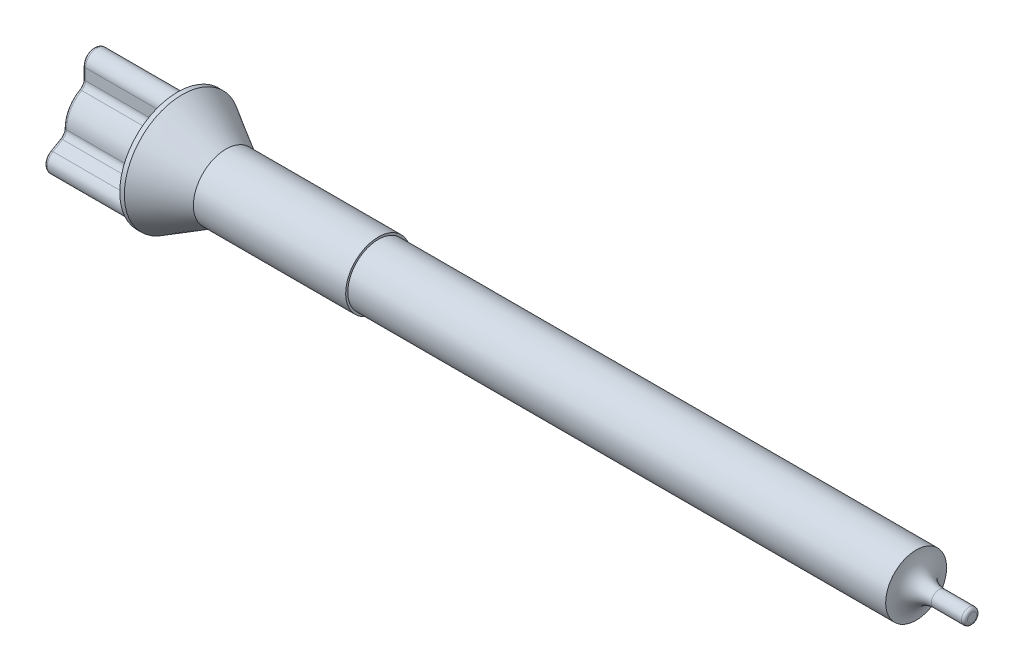
from build123d import *

# Parameters (mm, degrees)
Y_KSEKLIK_EKSTR_ZYON1_DEPTH = 2.75
DAIRESEL_KAPLAMA1_COUNT     = 3
RADYUS1_R                   = 0.25
IZIM3_R                     = 0.25
Y_KSEKLIK_EKSTR_ZYON2_DEPTH = 1.84
RADYUS2_R                   = 0.75
RADYUS3_R                   = 0.1


with BuildPart() as part:
    # Çizim1 → Döndür1 (revolve)
    with BuildSketch(Plane.XY):
        Polygon((0, 0), (0, 1), (2.75, 1), (2.75, 1.9), (2.9, 1.9), (4.33760217, 1.07), (9.33760217, 1.07), (9.33760217, 1), (26.99760217, 1), (26.99760217, 0), align=None)
    revolve(axis=Axis((26.99760217, 0, 0), (-1, 0, 0)))

    # Çizim2 → Yükseklik-Ekstrüzyon1 (add)
    with BuildSketch(Plane.ZY):
        with BuildLine():
            Line((-0.375, 0), (0.375, 0))
            Line((0.375, 0), (0.375, 1.45))
            ThreePointArc((0.375, 1.45), (0, 1.825), (-0.375, 1.45))
            Line((-0.375, 1.45), (-0.375, 0))
        make_face()
    y_kseklik_ekstr_zyon1 = extrude(amount=-Y_KSEKLIK_EKSTR_ZYON1_DEPTH)

    # Dairesel Kaplama1: Yükseklik-Ekstrüzyon1 ×3 about axis
    dairesel_kaplama1_axis = Axis((0, 0, 0), (1, 0, 0))
    for i in range(1, DAIRESEL_KAPLAMA1_COUNT):
        add(y_kseklik_ekstr_zyon1.rotate(dairesel_kaplama1_axis, i * 360 / DAIRESEL_KAPLAMA1_COUNT))

    # Radyus1
    radyus1_edges = [part.edges().sort_by_distance(p)[0] for p in [
        (2.75, 0.5, 0.866025404),
        (1.375, 0.927024811, -0.375),
        (1.375, 0.927024811, 0.375),
        (2.75, -1, 0),
        (2.75, 0.5, -0.866025404),
        (1.375, -0.138752879, 0.990327036),
        (1.375, -0.788271932, 0.615327036),
        (1.375, -0.788271932, -0.615327036),
        (1.375, -0.138752879, -0.990327036),
    ]]
    fillet(radyus1_edges, radius=RADYUS1_R)

    # Çizim3 → Yükseklik-Ekstrüzyon2 (add)
    with BuildSketch(Plane(origin=(26.99760217, 0, 0), x_dir=(0, 0, -1), z_dir=(1, 0, 0))):
        with Locations(Location((0, 0, 0), (0, 0, 90))):
            Circle(IZIM3_R)
    extrude(amount=Y_KSEKLIK_EKSTR_ZYON2_DEPTH)

    # Radyus2
    radyus2_edges = [part.edges().sort_by_distance(p)[0] for p in [
        (26.99760217, -0.25, 0),
    ]]
    fillet(radyus2_edges, radius=RADYUS2_R - 0.0001)  # a hair under: the kernel refuses the full size

    # Radyus3
    radyus3_edges = [part.edges().sort_by_distance(p)[0] for p in [
        (28.83760217, -0.25, 0),
        (0, 1.825, 0),
        (0, 1.266265877, -0.375),
        (0, -0.9125, -1.580496362),
        (0, -0.957892465, -0.909118418),
        (0, -0.9125, 1.580496362),
        (0, -0.308373412, 1.284118418),
        (0, 0.4999999999999995, -0.8660254037844389),
        (0, -0.308373412, -1.284118418),
        (0, -1, 0),
        (0, -0.957892465, 0.909118418),
        (0, 0.49999999999999933, 0.866025403784439),
        (0, 1.266265877, 0.375),
        (0, 0.957531755, -0.408493649),
        (0, -0.125, -1.033493649),
        (0, -0.832531755, -0.625),
        (0, -0.832531755, 0.625),
        (0, -0.125, 1.033493649),
        (0, 0.957531755, 0.408493649),
    ]]
    fillet(radyus3_edges, radius=RADYUS3_R)


solid = part.part
